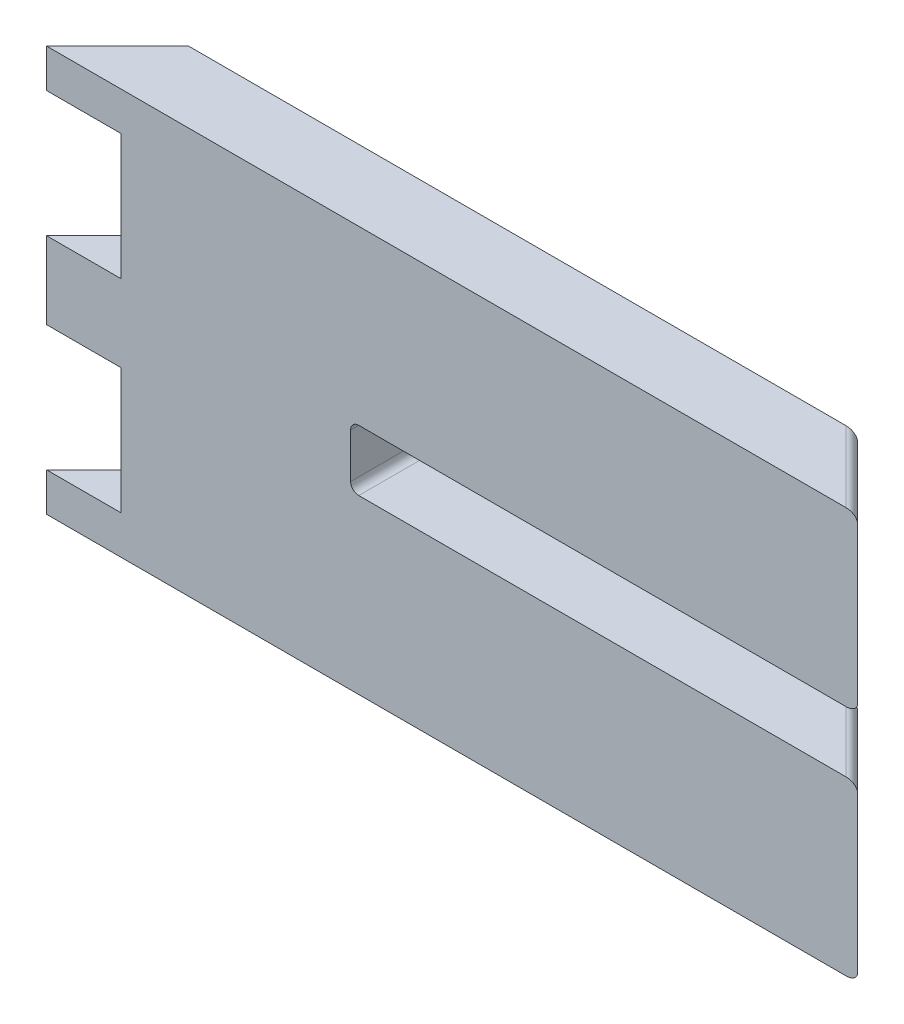
from build123d import *

# Parameters (mm, degrees)
BOSS_EXTRUDE1_DEPTH = 3.5
CUT_EXTRUDE1_DEPTH  = 29.5
CUT_EXTRUDE2_DEPTH  = 29.5
CAVITY1_START       = -8
CAVITY1_DEPTH       = 6
CAVITY1_START_2     = 2
CAVITY1_2_DEPTH     = 6
SKETCH4_W           = 4.949747468
SKETCH4_H           = 6
CUT_EXTRUDE3_DEPTH  = 0.1
CUT_EXTRUDE4_DEPTH  = 0.1
CUT_EXTRUDE5_DEPTH  = 0.1
CUT_EXTRUDE6_DEPTH  = 0.1
CUT_EXTRUDE7_DEPTH  = 0.1
SKETCH9_W           = 19.9
SKETCH9_H           = 5.3
SKETCH9_W_2         = 4.764466094
SKETCH9_H_2         = 16.8
CUT_EXTRUDE8_DEPTH  = 1.2
FILLET1_R           = 0.4


# Read off the part's stored shape, not the designer's step: Cavity1
with BuildPart() as part:
    # Sketch1 → Boss-Extrude1 (new body)
    with BuildSketch(Plane.XY):
        Polygon((20, -1.5), (20, -10), (-20, -10), (-20, 10), (20, 10), (20, 1.5), (-5, 1.5), (-5, -1.5), align=None)
    extrude(amount=BOSS_EXTRUDE1_DEPTH)

    # Sketch2 → Cut-Extrude1 (cut, through all)
    with BuildSketch(Plane(origin=(0, 10, 0), x_dir=(1, 0, 0), z_dir=(0, 1, 0))):
        Polygon((20, -3.5), (16.5, 0), (20, 0), align=None)
    extrude(amount=-CUT_EXTRUDE1_DEPTH, mode=Mode.SUBTRACT)

    # Sketch3 → Cut-Extrude2 (cut, through all)
    with BuildSketch(Plane(origin=(0, 10, 0), x_dir=(1, 0, 0), z_dir=(0, 1, 0))):
        Polygon((-20, -3.5), (-16.5, 0), (-20, 0), align=None)
    extrude(amount=-CUT_EXTRUDE2_DEPTH, mode=Mode.SUBTRACT)

    # Cavity1 outline → Cavity1 (cut)
    with BuildSketch(Plane(origin=(0, 0, 0), x_dir=(1, 0, 0), z_dir=(0, 1, 0)).offset(CAVITY1_START)):
        Polygon((-16.464466094, -3.5), (-12.964466094, 0), (-16.5, 0), (-20, -3.5), align=None)
    extrude(amount=CAVITY1_DEPTH, mode=Mode.SUBTRACT)

    # Cavity1 2 outline → Cavity1 2 (cut)
    with BuildSketch(Plane(origin=(0, 0, 0), x_dir=(1, 0, 0), z_dir=(0, 1, 0)).offset(CAVITY1_START_2)):
        Polygon((-16.464466094, -3.5), (-12.964466094, 0), (-16.5, 0), (-20, -3.5), align=None)
    extrude(amount=CAVITY1_2_DEPTH, mode=Mode.SUBTRACT)

    # Sketch4 → Cut-Extrude3 (cut)
    with BuildSketch(Plane(origin=(-6.482233047, 0, -6.482233047), x_dir=(-0.7071067811865464, 0, 0.7071067811865488), z_dir=(-0.7071067811865488, 0, -0.7071067811865464))):
        with Locations((11.642135624, -5)):
            Rectangle(SKETCH4_W, SKETCH4_H)
        with Locations((11.642135624, 5)):
            Rectangle(SKETCH4_W, SKETCH4_H)
    extrude(amount=-CUT_EXTRUDE3_DEPTH, mode=Mode.SUBTRACT)

    # Sketch5 → Cut-Extrude4 (cut)
    with BuildSketch(Plane.XZ.offset(2)):
        Polygon((-16.5, 0), (-12.964466094, 0), (-12.893755416, 0.070710678), (-16.323044738, 3.5), (-20, 3.5), align=None)
    extrude(amount=-CUT_EXTRUDE4_DEPTH, mode=Mode.SUBTRACT)

    # Sketch6 → Cut-Extrude5 (cut)
    with BuildSketch(Plane.XZ.offset(-8)):
        Polygon((-16.323044738, 3.5), (-20, 3.5), (-16.5, 0), (-12.964466094, 0), (-12.893755416, 0.070710678), align=None)
    extrude(amount=-CUT_EXTRUDE5_DEPTH, mode=Mode.SUBTRACT)

    # Sketch7 → Cut-Extrude6 (cut)
    with BuildSketch(Plane(origin=(0, 2, 0), x_dir=(1, 0, 0), z_dir=(0, 1, 0))):
        Polygon((-20, -3.5), (-16.323044738, -3.5), (-12.893755416, -0.070710678), (-12.964466094, 0), (-16.5, 0), align=None)
    extrude(amount=-CUT_EXTRUDE6_DEPTH, mode=Mode.SUBTRACT)

    # Sketch8 → Cut-Extrude7 (cut)
    with BuildSketch(Plane(origin=(0, -8, 0), x_dir=(1, 0, 0), z_dir=(0, 1, 0))):
        Polygon((-20, -3.5), (-16.323044738, -3.5), (-12.893755416, -0.070710678), (-12.964466094, 0), (-16.5, 0), align=None)
    extrude(amount=-CUT_EXTRUDE7_DEPTH, mode=Mode.SUBTRACT)

    # Sketch9 → Cut-Extrude8 (cut)
    with BuildSketch(Plane(origin=(0, 0, 0), x_dir=(-1, 0, 0), z_dir=(0, 0, -1))):
        with Locations((-4.95, 5.75)):
            Rectangle(SKETCH9_W, SKETCH9_H)
        with Locations((-4.95, -5.75)):
            Rectangle(SKETCH9_W, SKETCH9_H)
        with Locations((8.982233047, 0)):
            Rectangle(SKETCH9_W_2, SKETCH9_H_2)
    extrude(amount=-CUT_EXTRUDE8_DEPTH, mode=Mode.SUBTRACT)

    # Fillet1
    fillet1_edges = [part.edges().sort_by_distance(p)[0] for p in [
        (-5, 1.5, 1.75),
        (-5, -1.5, 1.75),
        (-6.6, -8.4, 0.6),
        (-6.6, 8.4, 0.6),
        (-11.364466094, 8.4, 0.6),
        (-11.364466094, -8.4, 0.6),
        (14.9, -8.4, 0.6),
        (14.9, -3.1, 0.6),
        (-5, -3.1, 0.6),
        (-5, -8.4, 0.6),
        (14.9, 3.1, 0.6),
        (14.9, 8.4, 0.6),
        (-5, 8.4, 0.6),
        (-5, 3.1, 0.6),
        (18.25, -1.5, 1.75),
        (18.25, -10, 1.75),
        (18.25, 1.5, 1.75),
        (18.25, 10, 1.75),
    ]]
    fillet(fillet1_edges, radius=FILLET1_R)


solid = part.part
